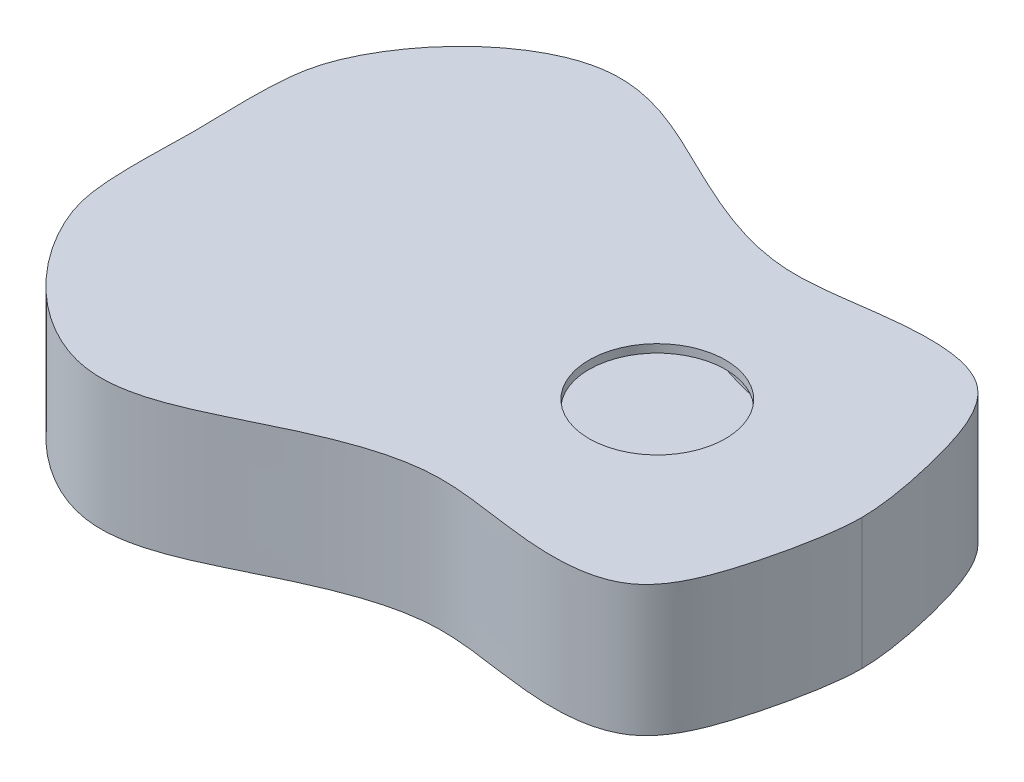
from build123d import *

# Parameters (mm, degrees)
BOSS_EXTRUDE1_DEPTH = 45
SHELL1_T            = -3
BOSS_EXTRUDE2_DEPTH = 3
SKETCH3_R           = 25
CUT_EXTRUDE1_DEPTH  = 4


with BuildPart() as part:
    # Sketch1 → Boss-Extrude1 (new body)
    with BuildSketch(Plane(origin=(0, 0, 0), x_dir=(1, 0, 0), z_dir=(0, 1, 0))):
        with BuildLine():
            add(Edge.make_bspline(
                [(-114.651810585, 0), (-114.651810585, 10.2831569), (-116.183727551, 33.461215019), (-105.022673434, 68.032789312), (-63.704049272, 107.927289765), (-9.823185498, 79.917084756), (31.907912662, 61.165557091), (71.696957798, 69.175573427), (112.055825367, 70.685590948), (125.661464083, 34.593088303), (130.348189415, 8.991839551), (130.348189415, 0)],
                knots=[0, 0, 0, 0, 0.091094922, 0.122895987, 0.318010649, 0.456437006, 0.603370108, 0.69640581, 0.808485937, 0.895846308, 1, 1, 1, 1], degree=3))
            add(Edge.make_bspline(
                [(-114.651810585, 0), (-114.651810585, -10.2831569), (-116.183727551, -33.461215019), (-105.022673434, -68.032789312), (-63.704049272, -107.927289765), (-9.823185498, -79.917084756), (31.907912662, -61.165557091), (71.696957798, -69.175573427), (112.055825367, -70.685590948), (125.661464083, -34.593088303), (130.348189415, -8.991839551), (130.348189415, 0)],
                knots=[0, 0, 0, 0, 0.091094922, 0.122895987, 0.318010649, 0.456437006, 0.603370108, 0.69640581, 0.808485937, 0.895846308, 1, 1, 1, 1], degree=3))
        make_face()
    extrude(amount=BOSS_EXTRUDE1_DEPTH)

    # Shell1
    shell1_openings = [part.faces().sort_by_distance(p)[0] for p in [
        (-0.508051607, 45, 0),
    ]]
    offset(amount=SHELL1_T, openings=shell1_openings, kind=Kind.INTERSECTION)

    # Sketch2 → Boss-Extrude2 (add)
    with BuildSketch(Plane(origin=(0, 45, 0), x_dir=(1, 0, 0), z_dir=(0, 1, 0))):
        with BuildLine():
            add(Edge.make_bspline(
                [(-114.651810585, 0), (-114.651810585, -10.2831569), (-116.183727551, -33.461215019), (-105.022673434, -68.032789312), (-63.704049272, -107.927289765), (-9.823185498, -79.917084756), (31.907912662, -61.165557091), (71.696957798, -69.175573427), (112.055825367, -70.685590948), (125.661464083, -34.593088303), (130.348189415, -8.991839551), (130.348189415, 0)],
                knots=[0, 0, 0, 0, 0.091094922, 0.122895987, 0.318010649, 0.456437006, 0.603370108, 0.69640581, 0.808485937, 0.895846308, 1, 1, 1, 1], degree=3))
            add(Edge.make_bspline(
                [(130.348189415, 0), (130.348189415, 8.991839551), (125.661464083, 34.593088303), (112.055825367, 70.685590948), (71.696957798, 69.175573427), (31.907912662, 61.165557091), (-9.823185498, 79.917084756), (-63.704049272, 107.927289765), (-105.022673434, 68.032789312), (-116.183727551, 33.461215019), (-114.651810585, 10.2831569), (-114.651810585, 0)],
                knots=[0, 0, 0, 0, 0.104153692, 0.191514063, 0.30359419, 0.396629892, 0.543562994, 0.681989351, 0.877104013, 0.908905078, 1, 1, 1, 1], degree=3))
        make_face()
    extrude(amount=BOSS_EXTRUDE2_DEPTH)

    # Sketch3 → Cut-Extrude1 (cut)
    with BuildSketch(Plane(origin=(0, 48, 0), x_dir=(1, 0, 0), z_dir=(0, 1, 0))):
        with Locations((55.348189415, 0)):
            Circle(SKETCH3_R)
    extrude(amount=-CUT_EXTRUDE1_DEPTH, mode=Mode.SUBTRACT)


solid = part.part
